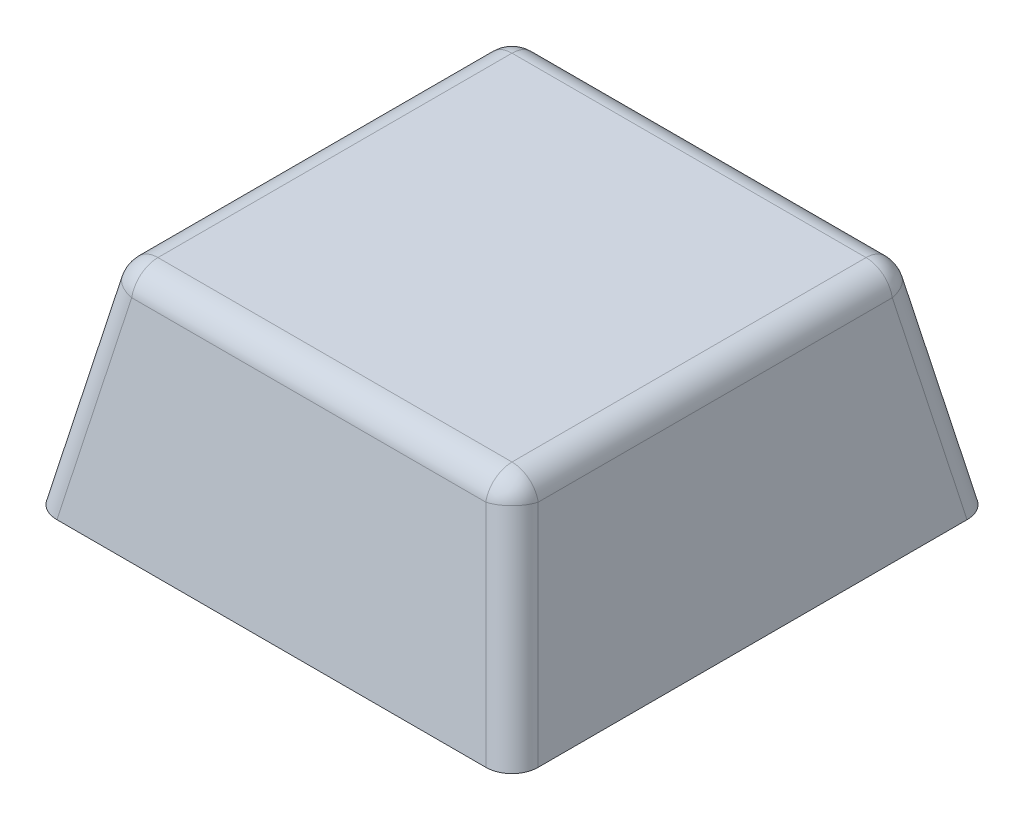
from build123d import *

# Parameters (mm, degrees)
SKETCH2_W           = 18
SKETCH2_H           = 18
BOSS_EXTRUDE1_DEPTH = 8
BOSS_EXTRUDE1_TAPER = 11
FILLET1_R           = 1
SHELL1_OUTLINE_W    = 13.241242282
SHELL1_OUTLINE_H    = 13.241242282
SHELL1_DEPTH        = 7
SHELL1_DRAFT        = 11
SKETCH3_R           = 2.8
BOSS_EXTRUDE2_DEPTH = 5.5
SKETCH4_W           = 1.161559242
SKETCH4_H           = 1.419220379
SKETCH4_H_2         = 1.161559242
SKETCH4_W_2         = 1.419220379
CUT_EXTRUDE1_DEPTH  = 5.5


# Read off the part's stored shape, not the designer's step: Shell1
with BuildPart() as part:
    # Sketch2 → Boss-Extrude1 (new body)
    with BuildSketch(Plane(origin=(0, 0, 0), x_dir=(1, 0, 0), z_dir=(0, 1, 0))):
        Rectangle(SKETCH2_W, SKETCH2_H)
    extrude(amount=BOSS_EXTRUDE1_DEPTH, taper=BOSS_EXTRUDE1_TAPER)

    # Fillet1
    fillet1_edges = [part.edges().sort_by_distance(p)[0] for p in [
        (-7.444957527, 8, 0),
        (0, 8, 7.444957527),
        (7.444957527, 8, 0),
        (8.222478763, 4, 8.222478763),
        (-8.222478763, 4, 8.222478763),
        (-8.222478763, 4, -8.222478763),
        (8.222478763, 4, -8.222478763),
        (0, 8, -7.444957527),
    ]]
    fillet(fillet1_edges, radius=FILLET1_R)


with BuildPart() as shell1_tool:
    # Shell1 outline → Shell1 (with draft: the straight prism first)
    with BuildSketch(Plane(origin=(0, 7, 0), x_dir=(1, 0, 0), z_dir=(0, 1, 0))):
        Rectangle(SHELL1_OUTLINE_W, SHELL1_OUTLINE_H)
    extrude(amount=-SHELL1_DEPTH)
    # Shell1: the draft: its side faces are tilted about the plane it starts from
    shell1_sides = [shell1_tool.faces().sort_by_distance(p)[0] for p in [
        (0, 3.5, -6.620621141),
        (-6.620621141, 3.5, 0),
        (0, 3.5, 6.620621141),
        (6.620621141, 3.5, 0),
    ]]
    draft(shell1_sides, Plane(origin=(0, 7, 0), x_dir=(1, 0, 0), z_dir=(0, 1, 0)), SHELL1_DRAFT)


with BuildPart() as part_1:
    add(part.part)

    # Shell1: cut by shell1_tool
    add(shell1_tool.part, mode=Mode.SUBTRACT)

    # Sketch3 → Boss-Extrude2 (add)
    with BuildSketch(Plane.XZ.offset(-7)):
        with Locations(Location((0, 0, 0), (0, 0, 270))):
            Circle(SKETCH3_R)
    extrude(amount=BOSS_EXTRUDE2_DEPTH)

    # Sketch4 → Cut-Extrude1 (cut)
    with BuildSketch(Plane.XZ.offset(-1.5)):
        with Locations((0, -1.290389811)):
            Rectangle(SKETCH4_W, SKETCH4_H)
        Rectangle(SKETCH4_W, SKETCH4_H_2)
        with Locations((-1.290389811, 0)):
            Rectangle(SKETCH4_W_2, SKETCH4_H_2)
        with Locations((1.290389811, 0)):
            Rectangle(SKETCH4_W_2, SKETCH4_H_2)
        with Locations((0, 1.290389811)):
            Rectangle(SKETCH4_W, SKETCH4_H)
    extrude(amount=-CUT_EXTRUDE1_DEPTH, mode=Mode.SUBTRACT)


solid = part_1.part
